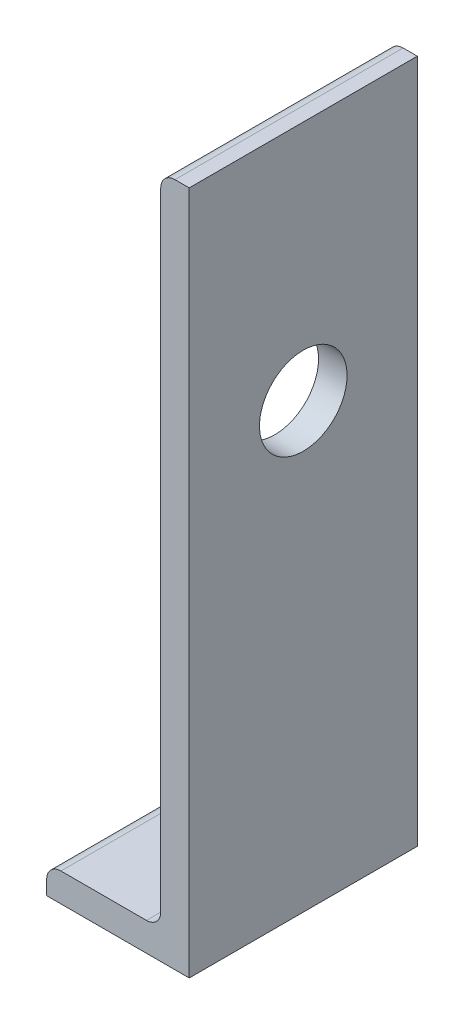
from build123d import *

# Parameters (mm, degrees)
BOSS_EXTRUDE1_DEPTH = 25.4
SKETCH3_R           = 4.765
CUT_EXTRUDE1_DEPTH  = 156.31560007
SKETCH4_R           = 9.75
CUT_EXTRUDE2_DEPTH  = 12.7


with BuildPart() as part:
    # Sketch2 → Boss-Extrude1 (new, symmetric)
    with BuildSketch(Plane.XY):
        with BuildLine():
            Line((-15.875, 0), (15.875, 0))
            Line((15.875, 0), (15.875, 152.4))
            Line((15.875, 152.4), (12.7, 152.4))
            ThreePointArc((12.7, 152.4), (10.45493597, 151.47006403), (9.525, 149.225))
            Line((9.525, 149.225), (9.525, 9.525))
            ThreePointArc((9.525, 9.525), (8.59506403, 7.27993597), (6.35, 6.35))
            Line((6.35, 6.35), (-12.7, 6.35))
            ThreePointArc((-12.7, 6.35), (-14.94506403, 5.42006403), (-15.875, 3.175))
            Line((-15.875, 3.175), (-15.875, 0))
        make_face()
    extrude(amount=BOSS_EXTRUDE1_DEPTH, both=True)

    # Sketch3 → Cut-Extrude1 (cut, through all)
    with BuildSketch(Plane.XZ):
        with Locations((-4.826, 0)):
            Circle(SKETCH3_R)
    extrude(amount=-CUT_EXTRUDE1_DEPTH, mode=Mode.SUBTRACT)

    # Sketch4 → Cut-Extrude2 (cut)
    with BuildSketch(Plane(origin=(15.875, 0, 0), x_dir=(0, 0, -1), z_dir=(1, 0, 0))):
        with Locations((0, 98.65)):
            Circle(SKETCH4_R)
    extrude(amount=-CUT_EXTRUDE2_DEPTH, mode=Mode.SUBTRACT)


solid = part.part
